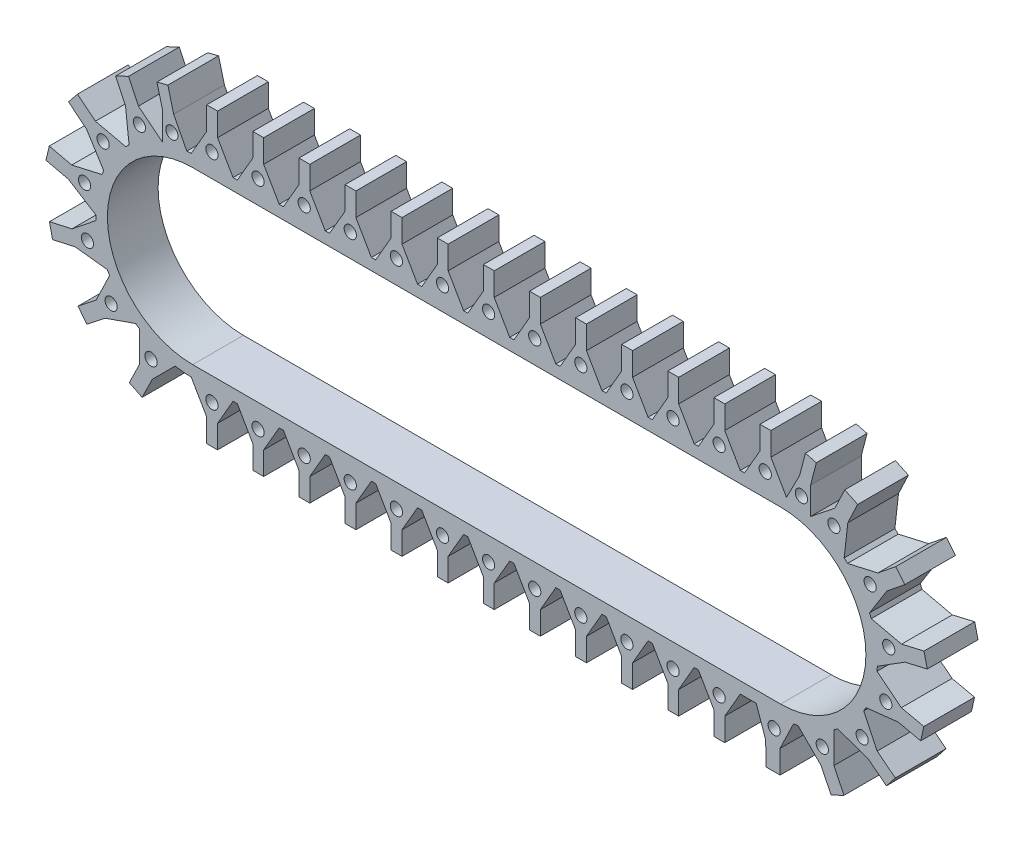
from build123d import *

# Parameters (mm, degrees)
SKETCH1_R                        = 5.304855617
BOSS_EXTRUDE1_DEPTH              = 44
SKIZZE1_W                        = 9.41415406
SKIZZE1_H                        = 44
AUFSATZ_LINEAR_AUSTRAGEN1_DEPTH  = 20
SKIZZE2_W                        = 9.41415406
SKIZZE2_H                        = 44
AUFSATZ_LINEAR_AUSTRAGEN2_DEPTH  = 20
SKIZZE3_W                        = 9.41415406
SKIZZE3_H                        = 44
AUFSATZ_LINEAR_AUSTRAGEN3_DEPTH  = 20
SKIZZE4_W                        = 9.41415406
SKIZZE4_H                        = 44
AUFSATZ_LINEAR_AUSTRAGEN4_DEPTH  = 20
SKIZZE5_W                        = 9.41415406
SKIZZE5_H                        = 44
AUFSATZ_LINEAR_AUSTRAGEN5_DEPTH  = 20
SKIZZE6_W                        = 9.41415406
SKIZZE6_H                        = 44
AUFSATZ_LINEAR_AUSTRAGEN6_DEPTH  = 20
SKIZZE7_W                        = 9.41415406
SKIZZE7_H                        = 44
AUFSATZ_LINEAR_AUSTRAGEN7_DEPTH  = 20
SKIZZE8_W                        = 9.41415406
SKIZZE8_H                        = 44
AUFSATZ_LINEAR_AUSTRAGEN8_DEPTH  = 20
SKIZZE9_W                        = 9.41415406
SKIZZE9_H                        = 44
AUFSATZ_LINEAR_AUSTRAGEN9_DEPTH  = 20
SKIZZE10_W                       = 9.41415406
SKIZZE10_H                       = 44
AUFSATZ_LINEAR_AUSTRAGEN10_DEPTH = 20
SKIZZE11_W                       = 9.41415406
SKIZZE11_H                       = 44
AUFSATZ_LINEAR_AUSTRAGEN11_DEPTH = 20
SKIZZE12_W                       = 9.803304207
SKIZZE12_H                       = 44
AUFSATZ_LINEAR_AUSTRAGEN12_DEPTH = 20
SKIZZE13_W                       = 12.432660884
SKIZZE13_H                       = 44
AUFSATZ_LINEAR_AUSTRAGEN13_DEPTH = 20
SKIZZE14_W                       = 44
SKIZZE14_H                       = 12.432660884
AUFSATZ_LINEAR_AUSTRAGEN14_DEPTH = 20
SKIZZE15_W                       = 44
SKIZZE15_H                       = 12.432660884
AUFSATZ_LINEAR_AUSTRAGEN15_DEPTH = 20
SKIZZE16_W                       = 44
SKIZZE16_H                       = 12.432660884
AUFSATZ_LINEAR_AUSTRAGEN16_DEPTH = 20
SKIZZE17_W                       = 44
SKIZZE17_H                       = 12.432660883
AUFSATZ_LINEAR_AUSTRAGEN17_DEPTH = 20
SKIZZE18_W                       = 12.432660884
SKIZZE18_H                       = 44
AUFSATZ_LINEAR_AUSTRAGEN18_DEPTH = 20
SKIZZE19_W                       = 9.41415406
SKIZZE19_H                       = 44
AUFSATZ_LINEAR_AUSTRAGEN19_DEPTH = 20
SKIZZE20_W                       = 9.41415406
SKIZZE20_H                       = 44
AUFSATZ_LINEAR_AUSTRAGEN20_DEPTH = 20
SKIZZE21_W                       = 9.41415406
SKIZZE21_H                       = 44
AUFSATZ_LINEAR_AUSTRAGEN21_DEPTH = 20
SKIZZE22_W                       = 9.41415406
SKIZZE22_H                       = 44
AUFSATZ_LINEAR_AUSTRAGEN22_DEPTH = 20
SKIZZE23_W                       = 9.41415406
SKIZZE23_H                       = 44
AUFSATZ_LINEAR_AUSTRAGEN23_DEPTH = 20
SKIZZE24_W                       = 9.41415406
SKIZZE24_H                       = 44
AUFSATZ_LINEAR_AUSTRAGEN24_DEPTH = 20
SKIZZE25_W                       = 9.41415406
SKIZZE25_H                       = 44
AUFSATZ_LINEAR_AUSTRAGEN25_DEPTH = 20
SKIZZE26_W                       = 9.41415406
SKIZZE26_H                       = 44
AUFSATZ_LINEAR_AUSTRAGEN26_DEPTH = 20
SKIZZE27_W                       = 9.41415406
SKIZZE27_H                       = 44
AUFSATZ_LINEAR_AUSTRAGEN27_DEPTH = 20
SKIZZE28_W                       = 9.41415406
SKIZZE28_H                       = 44
AUFSATZ_LINEAR_AUSTRAGEN28_DEPTH = 20
SKIZZE29_W                       = 9.41415406
SKIZZE29_H                       = 44
AUFSATZ_LINEAR_AUSTRAGEN29_DEPTH = 20
SKIZZE30_W                       = 9.41415406
SKIZZE30_H                       = 44
AUFSATZ_LINEAR_AUSTRAGEN30_DEPTH = 20
SKIZZE31_W                       = 12.432660883
SKIZZE31_H                       = 44
AUFSATZ_LINEAR_AUSTRAGEN31_DEPTH = 20
SKIZZE32_W                       = 12.432660883
SKIZZE32_H                       = 44
AUFSATZ_LINEAR_AUSTRAGEN32_DEPTH = 20
SKIZZE33_W                       = 44
SKIZZE33_H                       = 12.432660883
AUFSATZ_LINEAR_AUSTRAGEN33_DEPTH = 20
SKIZZE34_W                       = 44
SKIZZE34_H                       = 12.432660883
AUFSATZ_LINEAR_AUSTRAGEN34_DEPTH = 20
SKIZZE35_W                       = 44
SKIZZE35_H                       = 12.432660884
AUFSATZ_LINEAR_AUSTRAGEN35_DEPTH = 20
SKIZZE36_W                       = 44
SKIZZE36_H                       = 12.432660883
AUFSATZ_LINEAR_AUSTRAGEN36_DEPTH = 20
SKIZZE37_W                       = 12.432660883
SKIZZE37_H                       = 44
AUFSATZ_LINEAR_AUSTRAGEN37_DEPTH = 20
SKIZZE38_W                       = 9.803304207
SKIZZE38_H                       = 44
AUFSATZ_LINEAR_AUSTRAGEN38_DEPTH = 20
SKIZZE39_W                       = 9.41415406
SKIZZE39_H                       = 44
AUFSATZ_LINEAR_AUSTRAGEN39_DEPTH = 20
SKIZZE40_W                       = 9.41415406
SKIZZE40_H                       = 44
AUFSATZ_LINEAR_AUSTRAGEN40_DEPTH = 20


with BuildPart() as part:
    # Sketch1 → Boss-Extrude1 (new body)
    with BuildSketch(Plane.XY):
        with BuildLine():
            Line((-368.279008081, 208.137347398), (-377.693162141, 208.137347398))
            Line((-377.693162141, 208.137347398), (-391.140624551, 184.84565927))
            ThreePointArc((-391.140624551, 184.84565927), (-393.055558066, 184.794572872), (-394.968828688, 184.699832656))
            Line((-394.968828688, 184.699832656), (-406.364309987, 206.757674175))
            Line((-406.364309987, 206.757674175), (-415.856306602, 204.306802161))
            Line((-415.856306602, 204.306802161), (-415.856306602, 180.730933767))
            Line((-415.856306602, 180.730933767), (-436.937315979, 197.542477756))
            Line((-436.937315979, 197.542477756), (-448.168387597, 192.210115525))
            Line((-448.168387597, 192.210115525), (-445.013595724, 164.210563225))
            ThreePointArc((-445.013595724, 164.210563225), (-446.491708161, 162.892805497), (-447.938347028, 161.540571127))
            Line((-447.938347028, 161.540571127), (-474.225935747, 167.540541709))
            Line((-474.225935747, 167.540541709), (-482.031156365, 157.863269999))
            Line((-482.031156365, 157.863269999), (-467.040236656, 134.005357956))
            ThreePointArc((-467.040236656, 134.005357956), (-467.800216295, 132.176770316), (-468.516880373, 130.330776165))
            Line((-468.516880373, 130.330776165), (-494.804469092, 124.330805583))
            Line((-494.804469092, 124.330805583), (-497.637919041, 112.225326739))
            Line((-497.637919041, 112.225326739), (-473.780006998, 97.234407031))
            ThreePointArc((-473.780006998, 97.234407031), (-473.671330551, 95.257163688), (-473.516075729, 93.283031538))
            Line((-473.516075729, 93.283031538), (-494.597085106, 76.471487549))
            Line((-494.597085106, 76.471487549), (-491.897564874, 64.335440122))
            Line((-491.897564874, 64.335440122), (-463.898012575, 61.180648248))
            ThreePointArc((-463.898012575, 61.180648248), (-462.942204744, 59.446366495), (-461.945781144, 57.73509743))
            Line((-461.945781144, 57.73509743), (-473.644858731, 33.441712501))
            Line((-473.644858731, 33.441712501), (-465.947041408, 23.678789521))
            Line((-465.947041408, 23.678789521), (-439.351503576, 32.984970704))
            ThreePointArc((-439.351503576, 32.984970704), (-437.737873826, 31.837146312), (-436.097635362, 30.727678157))
            Line((-436.097635362, 30.727678157), (-436.097635362, 3.764055113))
            Line((-436.097635362, 3.764055113), (-424.926168076, -1.692076789))
            Line((-424.926168076, -1.692076789), (-405.002217154, 18.231874134))
            ThreePointArc((-405.002217154, 18.231874134), (-398.099796392, 17.260748368), (-391.140624551, 16.865242473))
            Line((-391.140624551, 16.865242473), (-377.693162141, -6.426445656))
            Line((-377.693162141, -6.426445656), (-368.279008081, -6.426445656))
            Line((-368.279008081, -6.426445656), (-354.837198854, 16.855450871))
            Line((-354.837198854, 16.855450871), (-351.134971368, 16.855450871))
            Line((-351.134971368, 16.855450871), (-337.693162141, -6.426445656))
            Line((-337.693162141, -6.426445656), (-328.279008081, -6.426445656))
            Line((-328.279008081, -6.426445656), (-314.837198854, 16.855450871))
            Line((-314.837198854, 16.855450871), (-311.134971368, 16.855450871))
            Line((-311.134971368, 16.855450871), (-297.693162141, -6.426445656))
            Line((-297.693162141, -6.426445656), (-288.279008081, -6.426445656))
            Line((-288.279008081, -6.426445656), (-274.837198854, 16.855450871))
            Line((-274.837198854, 16.855450871), (-271.134971368, 16.855450871))
            Line((-271.134971368, 16.855450871), (-257.693162141, -6.426445656))
            Line((-257.693162141, -6.426445656), (-248.279008081, -6.426445656))
            Line((-248.279008081, -6.426445656), (-234.837198854, 16.855450871))
            Line((-234.837198854, 16.855450871), (-231.134971368, 16.855450871))
            Line((-231.134971368, 16.855450871), (-217.693162141, -6.426445656))
            Line((-217.693162141, -6.426445656), (-208.279008081, -6.426445656))
            Line((-208.279008081, -6.426445656), (-194.837198854, 16.855450871))
            Line((-194.837198854, 16.855450871), (-191.134971368, 16.855450871))
            Line((-191.134971368, 16.855450871), (-177.693162141, -6.426445656))
            Line((-177.693162141, -6.426445656), (-168.279008081, -6.426445656))
            Line((-168.279008081, -6.426445656), (-154.837198854, 16.855450871))
            Line((-154.837198854, 16.855450871), (-151.134971368, 16.855450871))
            Line((-151.134971368, 16.855450871), (-137.693162141, -6.426445656))
            Line((-137.693162141, -6.426445656), (-128.279008081, -6.426445656))
            Line((-128.279008081, -6.426445656), (-114.837198854, 16.855450871))
            Line((-114.837198854, 16.855450871), (-111.134971368, 16.855450871))
            Line((-111.134971368, 16.855450871), (-97.693162141, -6.426445656))
            Line((-97.693162141, -6.426445656), (-88.279008081, -6.426445656))
            Line((-88.279008081, -6.426445656), (-74.837198854, 16.855450871))
            Line((-74.837198854, 16.855450871), (-71.134971368, 16.855450871))
            Line((-71.134971368, 16.855450871), (-57.693162141, -6.426445656))
            Line((-57.693162141, -6.426445656), (-48.279008081, -6.426445656))
            Line((-48.279008081, -6.426445656), (-34.837198854, 16.855450871))
            Line((-34.837198854, 16.855450871), (-31.134971368, 16.855450871))
            Line((-31.134971368, 16.855450871), (-17.693162141, -6.426445656))
            Line((-17.693162141, -6.426445656), (-8.279008081, -6.426445656))
            Line((-8.279008081, -6.426445656), (5.162801146, 16.855450871))
            Line((5.162801146, 16.855450871), (8.865028632, 16.855450871))
            Line((8.865028632, 16.855450871), (22.306837859, -6.426445656))
            Line((22.306837859, -6.426445656), (31.720991919, -6.426445656))
            Line((31.720991919, -6.426445656), (45.162801146, 16.855450871))
            Line((45.162801146, 16.855450871), (48.865028632, 16.855450871))
            Line((48.865028632, 16.855450871), (62.306837859, -6.426445656))
            Line((62.306837859, -6.426445656), (71.720991919, -6.426445656))
            Line((71.720991919, -6.426445656), (85.162801146, 16.855450871))
            Line((85.162801146, 16.855450871), (88.865028632, 16.855450871))
            Line((88.865028632, 16.855450871), (88.971712538, 16.855450871))
            Line((88.971712538, 16.855450871), (98.982794632, 16.855450871))
            Line((98.982794632, 16.855450871), (107.129482574, -6.426445656))
            Line((107.129482574, -6.426445656), (107.243450607, -6.752147583))
            Line((107.243450607, -6.752147583), (119.675921751, -6.683460598))
            Line((119.675921751, -6.683460598), (131.374999338, 17.60992433))
            ThreePointArc((131.374999338, 17.60992433), (133.334183321, 17.897847801), (135.28603583, 18.231874134))
            Line((135.28603583, 18.231874134), (155.209986752, -1.692076789))
            Line((155.209986752, -1.692076789), (166.381454038, 3.764055113))
            Line((166.381454038, 3.764055113), (166.381454038, 30.727678157))
            ThreePointArc((166.381454038, 30.727678157), (168.021692502, 31.837146312), (169.635322252, 32.984970704))
            Line((169.635322252, 32.984970704), (196.230860084, 23.678789521))
            Line((196.230860084, 23.678789521), (203.928677407, 33.441712501))
            Line((203.928677407, 33.441712501), (192.22959982, 57.73509743))
            ThreePointArc((192.22959982, 57.73509743), (193.22602342, 59.446366495), (194.181831251, 61.180648248))
            Line((194.181831251, 61.180648248), (222.18138355, 64.335440122))
            Line((222.18138355, 64.335440122), (224.880903782, 76.471487549))
            Line((224.880903782, 76.471487549), (203.799894405, 93.283031538))
            ThreePointArc((203.799894405, 93.283031538), (203.955149227, 95.257163688), (204.063825674, 97.234407031))
            Line((204.063825674, 97.234407031), (227.921737717, 112.225326739))
            Line((227.921737717, 112.225326739), (225.088287768, 124.330805583))
            Line((225.088287768, 124.330805583), (198.800699049, 130.330776165))
            ThreePointArc((198.800699049, 130.330776165), (198.084034971, 132.176770316), (197.324055332, 134.005357956))
            Line((197.324055332, 134.005357956), (212.314975041, 157.863269999))
            Line((212.314975041, 157.863269999), (204.509754423, 167.540541709))
            Line((204.509754423, 167.540541709), (178.222165704, 161.540571127))
            ThreePointArc((178.222165704, 161.540571127), (176.775526837, 162.892805497), (175.2974144, 164.210563225))
            Line((175.2974144, 164.210563225), (178.452206273, 192.210115525))
            Line((178.452206273, 192.210115525), (167.221134655, 197.542477756))
            Line((167.221134655, 197.542477756), (146.140125278, 180.730933767))
            Line((146.140125278, 180.730933767), (146.140125278, 204.306802161))
            Line((146.140125278, 204.306802161), (136.648128663, 206.757674175))
            Line((136.648128663, 206.757674175), (125.252647364, 184.699832656))
            Line((125.252647364, 184.699832656), (111.720991919, 208.137347398))
            Line((111.720991919, 208.137347398), (102.306837859, 208.137347398))
            Line((102.306837859, 208.137347398), (88.865028632, 184.855450871))
            Line((88.865028632, 184.855450871), (85.162801146, 184.855450871))
            Line((85.162801146, 184.855450871), (76.790181677, 199.357253183))
            Line((76.790181677, 199.357253183), (71.720991919, 208.137347398))
            Line((71.720991919, 208.137347398), (62.306837859, 208.137347398))
            Line((62.306837859, 208.137347398), (48.865028632, 184.855450871))
            Line((48.865028632, 184.855450871), (45.162801146, 184.855450871))
            Line((45.162801146, 184.855450871), (31.720991919, 208.137347398))
            Line((31.720991919, 208.137347398), (22.306837859, 208.137347398))
            Line((22.306837859, 208.137347398), (8.865028632, 184.855450871))
            Line((8.865028632, 184.855450871), (5.162801146, 184.855450871))
            Line((5.162801146, 184.855450871), (-8.279008081, 208.137347398))
            Line((-8.279008081, 208.137347398), (-17.693162141, 208.137347398))
            Line((-17.693162141, 208.137347398), (-31.134971368, 184.855450871))
            Line((-31.134971368, 184.855450871), (-34.837198854, 184.855450871))
            Line((-34.837198854, 184.855450871), (-48.279008081, 208.137347398))
            Line((-48.279008081, 208.137347398), (-57.693162141, 208.137347398))
            Line((-57.693162141, 208.137347398), (-71.134971368, 184.855450871))
            Line((-71.134971368, 184.855450871), (-74.837198854, 184.855450871))
            Line((-74.837198854, 184.855450871), (-88.279008081, 208.137347398))
            Line((-88.279008081, 208.137347398), (-97.693162141, 208.137347398))
            Line((-97.693162141, 208.137347398), (-111.134971368, 184.855450871))
            Line((-111.134971368, 184.855450871), (-114.837198854, 184.855450871))
            Line((-114.837198854, 184.855450871), (-128.279008081, 208.137347398))
            Line((-128.279008081, 208.137347398), (-137.693162141, 208.137347398))
            Line((-137.693162141, 208.137347398), (-151.134971368, 184.855450871))
            Line((-151.134971368, 184.855450871), (-154.837198854, 184.855450871))
            Line((-154.837198854, 184.855450871), (-168.279008081, 208.137347398))
            Line((-168.279008081, 208.137347398), (-177.693162141, 208.137347398))
            Line((-177.693162141, 208.137347398), (-191.134971368, 184.855450871))
            Line((-191.134971368, 184.855450871), (-194.837198854, 184.855450871))
            Line((-194.837198854, 184.855450871), (-208.279008081, 208.137347398))
            Line((-208.279008081, 208.137347398), (-217.693162141, 208.137347398))
            Line((-217.693162141, 208.137347398), (-231.134971368, 184.855450871))
            Line((-231.134971368, 184.855450871), (-234.837198854, 184.855450871))
            Line((-234.837198854, 184.855450871), (-248.279008081, 208.137347398))
            Line((-248.279008081, 208.137347398), (-257.693162141, 208.137347398))
            Line((-257.693162141, 208.137347398), (-271.134971368, 184.855450871))
            Line((-271.134971368, 184.855450871), (-274.837198854, 184.855450871))
            Line((-274.837198854, 184.855450871), (-288.279008081, 208.137347398))
            Line((-288.279008081, 208.137347398), (-297.693162141, 208.137347398))
            Line((-297.693162141, 208.137347398), (-311.134971368, 184.855450871))
            Line((-311.134971368, 184.855450871), (-314.837198854, 184.855450871))
            Line((-314.837198854, 184.855450871), (-328.279008081, 208.137347398))
            Line((-328.279008081, 208.137347398), (-337.693162141, 208.137347398))
            Line((-337.693162141, 208.137347398), (-351.134971368, 184.855450871))
            Line((-351.134971368, 184.855450871), (-354.837198854, 184.855450871))
            Line((-354.837198854, 184.855450871), (-368.279008081, 208.137347398))
        make_face()
        with Locations((-426.021067812, 12.909443776)):
            Circle(SKETCH1_R, mode=Mode.SUBTRACT)
        with Locations((-373.153370384, 6.777668426)):
            Circle(SKETCH1_R, mode=Mode.SUBTRACT)
        with Locations((-333.153370384, 6.777668426)):
            Circle(SKETCH1_R, mode=Mode.SUBTRACT)
        with Locations((-460.598149643, 37.309364166)):
            Circle(SKETCH1_R, mode=Mode.SUBTRACT)
        with Locations((-293.153370384, 6.777668426)):
            Circle(SKETCH1_R, mode=Mode.SUBTRACT)
        with Locations((-253.153370384, 6.777668426)):
            Circle(SKETCH1_R, mode=Mode.SUBTRACT)
        with Locations((-213.153370384, 6.777668426)):
            Circle(SKETCH1_R, mode=Mode.SUBTRACT)
        with Locations((-173.153370384, 6.777668426)):
            Circle(SKETCH1_R, mode=Mode.SUBTRACT)
        with Locations((-481.164295224, 74.295366369)):
            Circle(SKETCH1_R, mode=Mode.SUBTRACT)
        with Locations((-133.153370384, 6.777668426)):
            Circle(SKETCH1_R, mode=Mode.SUBTRACT)
        with Locations((-93.153370384, 6.777668426)):
            Circle(SKETCH1_R, mode=Mode.SUBTRACT)
        with Locations((-53.153370384, 6.777668426)):
            Circle(SKETCH1_R, mode=Mode.SUBTRACT)
        with Locations((-13.153370384, 6.777668426)):
            Circle(SKETCH1_R, mode=Mode.SUBTRACT)
        with Locations((26.846629616, 6.777668426)):
            Circle(SKETCH1_R, mode=Mode.SUBTRACT)
        with Locations((66.846629616, 6.777668426)):
            Circle(SKETCH1_R, mode=Mode.SUBTRACT)
        with Locations((156.304886488, 12.909443776)):
            Circle(SKETCH1_R, mode=Mode.SUBTRACT)
        with Locations((190.881968319, 37.309364166)):
            Circle(SKETCH1_R, mode=Mode.SUBTRACT)
        with Locations((211.4481139, 74.295366369)):
            Circle(SKETCH1_R, mode=Mode.SUBTRACT)
        with Locations((-483.646127194, 116.541919046)):
            Circle(SKETCH1_R, mode=Mode.SUBTRACT)
        with Locations((-467.552088294, 155.681574319)):
            Circle(SKETCH1_R, mode=Mode.SUBTRACT)
        with Locations((-436.069800308, 183.962243445)):
            Circle(SKETCH1_R, mode=Mode.SUBTRACT)
        with Locations((-407.896104995, 192.210115525)):
            Circle(SKETCH1_R, mode=Mode.SUBTRACT)
        with Locations((-373.153370384, 194.933233316)):
            Circle(SKETCH1_R, mode=Mode.SUBTRACT)
        with Locations((-333.153370384, 194.933233316)):
            Circle(SKETCH1_R, mode=Mode.SUBTRACT)
        with Locations((-293.153370384, 194.933233316)):
            Circle(SKETCH1_R, mode=Mode.SUBTRACT)
        with Locations((-253.153370384, 194.933233316)):
            Circle(SKETCH1_R, mode=Mode.SUBTRACT)
        with Locations((-213.153370384, 194.933233316)):
            Circle(SKETCH1_R, mode=Mode.SUBTRACT)
        with Locations((-173.153370384, 194.933233316)):
            Circle(SKETCH1_R, mode=Mode.SUBTRACT)
        with BuildLine():
            Line((-389.858090662, 174.855450871), (-134.858090662, 174.855450871))
            Line((-134.858090662, 174.855450871), (120.141909338, 174.855450871))
            ThreePointArc((120.141909338, 174.855450871), (194.141909338, 100.855450871), (120.141909338, 26.855450871))
            Line((120.141909338, 26.855450871), (-389.858090662, 26.855450871))
            ThreePointArc((-389.858090662, 26.855450871), (-463.858090662, 100.855450871), (-389.858090662, 174.855450871))
        make_face(mode=Mode.SUBTRACT)
        with Locations((213.92994587, 116.541919046)):
            Circle(SKETCH1_R, mode=Mode.SUBTRACT)
        with Locations((-133.153370384, 194.933233316)):
            Circle(SKETCH1_R, mode=Mode.SUBTRACT)
        with Locations((-93.153370384, 194.933233316)):
            Circle(SKETCH1_R, mode=Mode.SUBTRACT)
        with Locations((-53.153370384, 194.933233316)):
            Circle(SKETCH1_R, mode=Mode.SUBTRACT)
        with Locations((-13.153370384, 194.933233316)):
            Circle(SKETCH1_R, mode=Mode.SUBTRACT)
        with Locations((26.846629616, 194.933233316)):
            Circle(SKETCH1_R, mode=Mode.SUBTRACT)
        with Locations((197.83590697, 155.681574319)):
            Circle(SKETCH1_R, mode=Mode.SUBTRACT)
        with Locations((66.846629616, 194.933233316)):
            Circle(SKETCH1_R, mode=Mode.SUBTRACT)
        with Locations((106.846629616, 194.933233316)):
            Circle(SKETCH1_R, mode=Mode.SUBTRACT)
        with Locations((166.353618984, 183.962243445)):
            Circle(SKETCH1_R, mode=Mode.SUBTRACT)
        with Locations((138.179923671, 192.210115525)):
            Circle(SKETCH1_R, mode=Mode.SUBTRACT)
        with Locations((114.565283522, 5.928308679)):
            Circle(SKETCH1_R, mode=Mode.SUBTRACT)
    extrude(amount=BOSS_EXTRUDE1_DEPTH)

    # Skizze1 → Aufsatz-Linear austragen1 (add)
    with BuildSketch(Plane(origin=(0, 208.137347398, 0), x_dir=(1, 0, 0), z_dir=(0, 1, 0))):
        with Locations((27.013914889, -22)):
            Rectangle(SKIZZE1_W, SKIZZE1_H)
    extrude(amount=AUFSATZ_LINEAR_AUSTRAGEN1_DEPTH)

    # Skizze2 → Aufsatz-Linear austragen2 (add)
    with BuildSketch(Plane(origin=(0, 208.137347398, 0), x_dir=(1, 0, 0), z_dir=(0, 1, 0))):
        with Locations((-12.986085111, -22)):
            Rectangle(SKIZZE2_W, SKIZZE2_H)
    extrude(amount=AUFSATZ_LINEAR_AUSTRAGEN2_DEPTH)

    # Skizze3 → Aufsatz-Linear austragen3 (add)
    with BuildSketch(Plane(origin=(0, 208.137347398, 0), x_dir=(1, 0, 0), z_dir=(0, 1, 0))):
        with Locations((-52.986085111, -22)):
            Rectangle(SKIZZE3_W, SKIZZE3_H)
    extrude(amount=AUFSATZ_LINEAR_AUSTRAGEN3_DEPTH)

    # Skizze4 → Aufsatz-Linear austragen4 (add)
    with BuildSketch(Plane(origin=(0, 208.137347398, 0), x_dir=(1, 0, 0), z_dir=(0, 1, 0))):
        with Locations((-92.986085111, -22)):
            Rectangle(SKIZZE4_W, SKIZZE4_H)
    extrude(amount=AUFSATZ_LINEAR_AUSTRAGEN4_DEPTH)

    # Skizze5 → Aufsatz-Linear austragen5 (add)
    with BuildSketch(Plane(origin=(0, 208.137347398, 0), x_dir=(1, 0, 0), z_dir=(0, 1, 0))):
        with Locations((-132.986085111, -22)):
            Rectangle(SKIZZE5_W, SKIZZE5_H)
    extrude(amount=AUFSATZ_LINEAR_AUSTRAGEN5_DEPTH)

    # Skizze6 → Aufsatz-Linear austragen6 (add)
    with BuildSketch(Plane(origin=(0, 208.137347398, 0), x_dir=(1, 0, 0), z_dir=(0, 1, 0))):
        with Locations((-172.986085111, -22)):
            Rectangle(SKIZZE6_W, SKIZZE6_H)
    extrude(amount=AUFSATZ_LINEAR_AUSTRAGEN6_DEPTH)

    # Skizze7 → Aufsatz-Linear austragen7 (add)
    with BuildSketch(Plane(origin=(0, 208.137347398, 0), x_dir=(1, 0, 0), z_dir=(0, 1, 0))):
        with Locations((-212.986085111, -22)):
            Rectangle(SKIZZE7_W, SKIZZE7_H)
    extrude(amount=AUFSATZ_LINEAR_AUSTRAGEN7_DEPTH)

    # Skizze8 → Aufsatz-Linear austragen8 (add)
    with BuildSketch(Plane(origin=(0, 208.137347398, 0), x_dir=(1, 0, 0), z_dir=(0, 1, 0))):
        with Locations((-252.986085111, -22)):
            Rectangle(SKIZZE8_W, SKIZZE8_H)
    extrude(amount=AUFSATZ_LINEAR_AUSTRAGEN8_DEPTH)

    # Skizze9 → Aufsatz-Linear austragen9 (add)
    with BuildSketch(Plane(origin=(0, 208.137347398, 0), x_dir=(1, 0, 0), z_dir=(0, 1, 0))):
        with Locations((-292.986085111, -22)):
            Rectangle(SKIZZE9_W, SKIZZE9_H)
    extrude(amount=AUFSATZ_LINEAR_AUSTRAGEN9_DEPTH)

    # Skizze10 → Aufsatz-Linear austragen10 (add)
    with BuildSketch(Plane(origin=(0, 208.137347398, 0), x_dir=(1, 0, 0), z_dir=(0, 1, 0))):
        with Locations((-332.986085111, -22)):
            Rectangle(SKIZZE10_W, SKIZZE10_H)
    extrude(amount=AUFSATZ_LINEAR_AUSTRAGEN10_DEPTH)

    # Skizze11 → Aufsatz-Linear austragen11 (add)
    with BuildSketch(Plane(origin=(0, 208.137347398, 0), x_dir=(1, 0, 0), z_dir=(0, 1, 0))):
        with Locations((-372.986085111, -22)):
            Rectangle(SKIZZE11_W, SKIZZE11_H)
    extrude(amount=AUFSATZ_LINEAR_AUSTRAGEN11_DEPTH)

    # Skizze12 → Aufsatz-Linear austragen12 (add)
    with BuildSketch(Plane(origin=(-75.447662284, 292.201694384, 0), x_dir=(0.9682446260031685, 0.25000468838800677, 0), z_dir=(-0.25000468838800677, 0.9682446260031685, 0))):
        with Locations((-346.671323544, -22)):
            Rectangle(SKIZZE12_W, SKIZZE12_H)
    extrude(amount=AUFSATZ_LINEAR_AUSTRAGEN12_DEPTH)

    # Skizze13 → Aufsatz-Linear austragen13 (add)
    with BuildSketch(Plane(origin=(-156.91401837, 330.493785245, 0), x_dir=(0.903352204551377, 0.4288995156585833, 0), z_dir=(-0.4288995156585833, 0.903352204551377, 0))):
        with Locations((-316.198745051, -22)):
            Rectangle(SKIZZE13_W, SKIZZE13_H)
    extrude(amount=AUFSATZ_LINEAR_AUSTRAGEN13_DEPTH)

    # Skizze14 → Aufsatz-Linear austragen14 (add)
    with BuildSketch(Plane(origin=(-369.189062207, 297.770091225, 0), x_dir=(0, 0, 1), z_dir=(-0.778374943317651, 0.6277996874921519, 0))):
        with Locations((22, -173.525865048)):
            Rectangle(SKIZZE14_W, SKIZZE14_H)
    extrude(amount=AUFSATZ_LINEAR_AUSTRAGEN14_DEPTH)

    # Skizze15 → Aufsatz-Linear austragen15 (add)
    with BuildSketch(Plane(origin=(-496.694038224, 116.257912268, 0), x_dir=(0, 0, 1), z_dir=(-0.9736836673104443, 0.2279037428672114, 0))):
        with Locations((22, 2.074753804)):
            Rectangle(SKIZZE15_W, SKIZZE15_H)
    extrude(amount=AUFSATZ_LINEAR_AUSTRAGEN15_DEPTH)

    # Skizze16 → Aufsatz-Linear austragen16 (add)
    with BuildSketch(Plane(origin=(-455.07058717, -101.22507053, 0), x_dir=(0, 0, 1), z_dir=(-0.9761423995458788, -0.21713133308855742, 0))):
        with Locations((22, 175.823255342)):
            Rectangle(SKIZZE16_W, SKIZZE16_H)
    extrude(amount=AUFSATZ_LINEAR_AUSTRAGEN16_DEPTH)

    # Skizze17 → Aufsatz-Linear austragen17 (add)
    with BuildSketch(Plane(origin=(-275.808747039, -217.468206514, 0), x_dir=(0, 0, 1), z_dir=(-0.7852641579503548, -0.619160885585096, 0))):
        with Locations((22, 313.306617951)):
            Rectangle(SKIZZE17_W, SKIZZE17_H)
    extrude(amount=AUFSATZ_LINEAR_AUSTRAGEN17_DEPTH)

    # Skizze18 → Aufsatz-Linear austragen18 (add)
    with BuildSketch(Plane(origin=(-82.505250433, -168.930063051, 0), x_dir=(0.8985580311815659, -0.43885471923987357, 0), z_dir=(-0.4388547192398735, -0.8985580311815657, 0))):
        with Locations((-387.294575542, 22)):
            Rectangle(SKIZZE18_W, SKIZZE18_H)
    extrude(amount=AUFSATZ_LINEAR_AUSTRAGEN18_DEPTH)

    # Skizze19 → Aufsatz-Linear austragen19 (add)
    with BuildSketch(Plane.XZ.offset(6.426445656)):
        with Locations((-372.986085111, 22)):
            Rectangle(SKIZZE19_W, SKIZZE19_H)
    extrude(amount=AUFSATZ_LINEAR_AUSTRAGEN19_DEPTH)

    # Skizze20 → Aufsatz-Linear austragen20 (add)
    with BuildSketch(Plane.XZ.offset(6.426445656)):
        with Locations((-332.986085111, 22)):
            Rectangle(SKIZZE20_W, SKIZZE20_H)
    extrude(amount=AUFSATZ_LINEAR_AUSTRAGEN20_DEPTH)

    # Skizze21 → Aufsatz-Linear austragen21 (add)
    with BuildSketch(Plane.XZ.offset(6.426445656)):
        with Locations((-292.986085111, 22)):
            Rectangle(SKIZZE21_W, SKIZZE21_H)
    extrude(amount=AUFSATZ_LINEAR_AUSTRAGEN21_DEPTH)

    # Skizze22 → Aufsatz-Linear austragen22 (add)
    with BuildSketch(Plane.XZ.offset(6.426445656)):
        with Locations((-252.986085111, 22)):
            Rectangle(SKIZZE22_W, SKIZZE22_H)
    extrude(amount=AUFSATZ_LINEAR_AUSTRAGEN22_DEPTH)

    # Skizze23 → Aufsatz-Linear austragen23 (add)
    with BuildSketch(Plane.XZ.offset(6.426445656)):
        with Locations((-212.986085111, 22)):
            Rectangle(SKIZZE23_W, SKIZZE23_H)
    extrude(amount=AUFSATZ_LINEAR_AUSTRAGEN23_DEPTH)

    # Skizze24 → Aufsatz-Linear austragen24 (add)
    with BuildSketch(Plane.XZ.offset(6.426445656)):
        with Locations((-172.986085111, 22)):
            Rectangle(SKIZZE24_W, SKIZZE24_H)
    extrude(amount=AUFSATZ_LINEAR_AUSTRAGEN24_DEPTH)

    # Skizze25 → Aufsatz-Linear austragen25 (add)
    with BuildSketch(Plane.XZ.offset(6.426445656)):
        with Locations((-132.986085111, 22)):
            Rectangle(SKIZZE25_W, SKIZZE25_H)
    extrude(amount=AUFSATZ_LINEAR_AUSTRAGEN25_DEPTH)

    # Skizze26 → Aufsatz-Linear austragen26 (add)
    with BuildSketch(Plane.XZ.offset(6.426445656)):
        with Locations((-92.986085111, 22)):
            Rectangle(SKIZZE26_W, SKIZZE26_H)
    extrude(amount=AUFSATZ_LINEAR_AUSTRAGEN26_DEPTH)

    # Skizze27 → Aufsatz-Linear austragen27 (add)
    with BuildSketch(Plane.XZ.offset(6.426445656)):
        with Locations((-52.986085111, 22)):
            Rectangle(SKIZZE27_W, SKIZZE27_H)
    extrude(amount=AUFSATZ_LINEAR_AUSTRAGEN27_DEPTH)

    # Skizze28 → Aufsatz-Linear austragen28 (add)
    with BuildSketch(Plane.XZ.offset(6.426445656)):
        with Locations((-12.986085111, 22)):
            Rectangle(SKIZZE28_W, SKIZZE28_H)
    extrude(amount=AUFSATZ_LINEAR_AUSTRAGEN28_DEPTH)

    # Skizze29 → Aufsatz-Linear austragen29 (add)
    with BuildSketch(Plane.XZ.offset(6.426445656)):
        with Locations((27.013914889, 22)):
            Rectangle(SKIZZE29_W, SKIZZE29_H)
    extrude(amount=AUFSATZ_LINEAR_AUSTRAGEN29_DEPTH)

    # Skizze30 → Aufsatz-Linear austragen30 (add)
    with BuildSketch(Plane.XZ.offset(6.426445656)):
        with Locations((67.013914889, 22)):
            Rectangle(SKIZZE30_W, SKIZZE30_H)
    extrude(amount=AUFSATZ_LINEAR_AUSTRAGEN30_DEPTH)

    # Skizze31 → Aufsatz-Linear austragen31 (add)
    with BuildSketch(Plane(origin=(0.040576506, -7.344422612, 0), x_dir=(0.9999847386114645, 0.00552472118401051, 0), z_dir=(0.00552472118401051, -0.9999847386114645, 0))):
        with Locations((113.420840633, 22)):
            Rectangle(SKIZZE31_W, SKIZZE31_H)
    extrude(amount=AUFSATZ_LINEAR_AUSTRAGEN31_DEPTH)

    # Skizze32 → Aufsatz-Linear austragen32 (add)
    with BuildSketch(Plane(origin=(30.559676613, -62.571146321, 0), x_dir=(0.8985580311815659, 0.43885471923987357, 0), z_dir=(0.4388547192398735, -0.8985580311815657, 0))):
        with Locations((144.938934674, 22)):
            Rectangle(SKIZZE32_W, SKIZZE32_H)
    extrude(amount=AUFSATZ_LINEAR_AUSTRAGEN32_DEPTH)

    # Skizze33 → Aufsatz-Linear austragen33 (add)
    with BuildSketch(Plane(origin=(109.491015535, -86.330890638, 0), x_dir=(0, 0, -1), z_dir=(0.7852641579503548, -0.619160885585096, 0))):
        with Locations((-22, 146.308908266)):
            Rectangle(SKIZZE33_W, SKIZZE33_H)
    extrude(amount=AUFSATZ_LINEAR_AUSTRAGEN33_DEPTH)

    # Skizze34 → Aufsatz-Linear austragen34 (add)
    with BuildSketch(Plane(origin=(198.070449194, -44.058429077, 0), x_dir=(0, 0, -1), z_dir=(0.9761423995458783, -0.21713133308855892, 0))):
        with Locations((-22, 117.259421336)):
            Rectangle(SKIZZE34_W, SKIZZE34_H)
    extrude(amount=AUFSATZ_LINEAR_AUSTRAGEN34_DEPTH)

    # Skizze35 → Aufsatz-Linear austragen35 (add)
    with BuildSketch(Plane(origin=(240.986946649, 56.406232298, 0), x_dir=(0, 0, -1), z_dir=(0.973683667310444, 0.22790374286721302, 0))):
        with Locations((-22, 63.54408104)):
            Rectangle(SKIZZE35_W, SKIZZE35_H)
    extrude(amount=AUFSATZ_LINEAR_AUSTRAGEN35_DEPTH)

    # Skizze36 → Aufsatz-Linear austragen36 (add)
    with BuildSketch(Plane(origin=(205.77677959, 165.969625601, 0), x_dir=(0, 0, -1), z_dir=(0.7783749433176502, 0.6277996874921529, 0))):
        with Locations((-22, -4.198130702)):
            Rectangle(SKIZZE36_W, SKIZZE36_H)
    extrude(amount=AUFSATZ_LINEAR_AUSTRAGEN36_DEPTH)

    # Skizze37 → Aufsatz-Linear austragen37 (add)
    with BuildSketch(Plane(origin=(107.298433653, 225.992972821, 0), x_dir=(0.9033522045513767, -0.4288995156585839, 0), z_dir=(0.4288995156585839, 0.9033522045513767, 0))):
        with Locations((72.550038048, -22)):
            Rectangle(SKIZZE37_W, SKIZZE37_H)
    extrude(amount=AUFSATZ_LINEAR_AUSTRAGEN37_DEPTH)

    # Skizze38 → Aufsatz-Linear austragen38 (add)
    with BuildSketch(Plane(origin=(58.589768678, 226.912659227, 0), x_dir=(0.9682446260031683, -0.25000468838800755, 0), z_dir=(0.25000468838800755, 0.9682446260031684, 0))):
        with Locations((85.520080431, -22)):
            Rectangle(SKIZZE38_W, SKIZZE38_H)
    extrude(amount=AUFSATZ_LINEAR_AUSTRAGEN38_DEPTH)

    # Skizze39 → Aufsatz-Linear austragen39 (add)
    with BuildSketch(Plane(origin=(0, 208.137347398, 0), x_dir=(1, 0, 0), z_dir=(0, 1, 0))):
        with Locations((107.013914889, -22)):
            Rectangle(SKIZZE39_W, SKIZZE39_H)
    extrude(amount=AUFSATZ_LINEAR_AUSTRAGEN39_DEPTH)

    # Skizze40 → Aufsatz-Linear austragen40 (add)
    with BuildSketch(Plane(origin=(0, 208.137347398, 0), x_dir=(1, 0, 0), z_dir=(0, 1, 0))):
        with Locations((67.013914889, -22)):
            Rectangle(SKIZZE40_W, SKIZZE40_H)
    extrude(amount=AUFSATZ_LINEAR_AUSTRAGEN40_DEPTH)


solid = part.part
